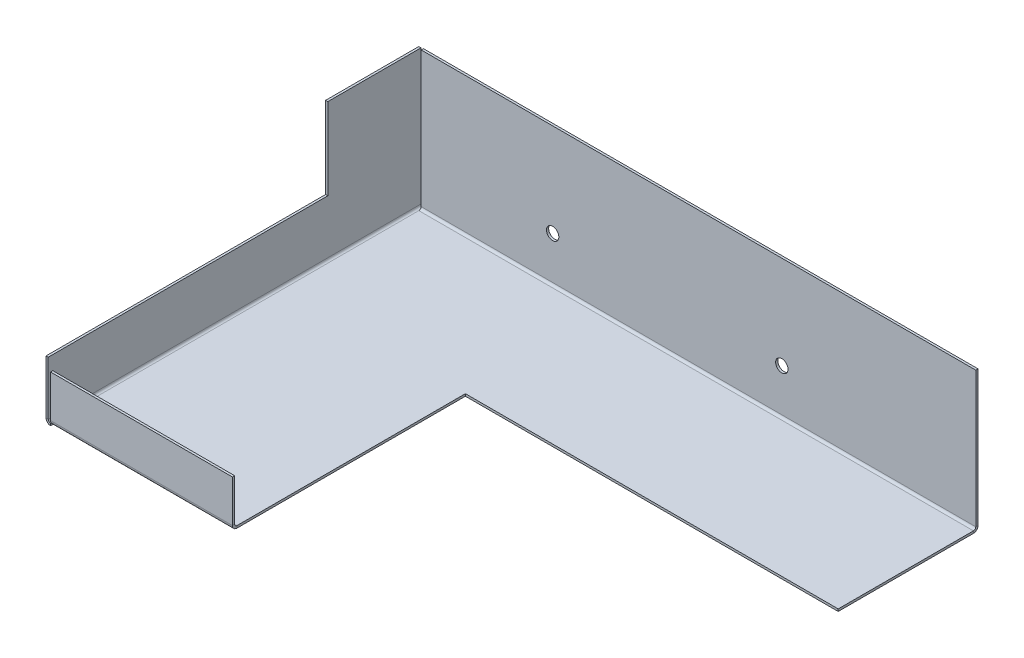
from build123d import *

# Parameters (mm, degrees)
BASE_FLANGE1_DEPTH           = 1.2192
EDGE_FLANGE1_STRIP_W         = 7.4168
EDGE_FLANGE1_STRIP_H         = 1.2192
EDGE_FLANGE1_STRIP_CUT_DEPTH = 203.2
EDGE_FLANGE1_DEPTH           = 203.2
EDGE_FLANGE2_STRIP_W         = 7.4168
EDGE_FLANGE2_STRIP_H         = 1.2192
EDGE_FLANGE2_STRIP_CUT_DEPTH = 302.3108
EDGE_FLANGE2_DEPTH           = 302.3108
F_1_4_0_25_DIAMETER_HOLE1_D  = 6.7564
SKETCH15_W                   = 152.4
SKETCH15_H                   = 44.45
CUT_EXTRUDE2_DEPTH           = 373.975962979
F_1_4_0_25_DIAMETER_HOLE3_D  = 6.7564
EDGE_FLANGE3_STRIP_W         = 7.4168
EDGE_FLANGE3_STRIP_H         = 1.2192
EDGE_FLANGE3_STRIP_CUT_DEPTH = 99.1108
EDGE_FLANGE3_DEPTH           = 99.1108


# Sheet-metal steps are written as plain solids
with BuildPart() as part:
    # Sketch1 → Base-Flange1 (new body)
    with BuildSketch(Plane(origin=(0, 0, 0), x_dir=(1, 0, 0), z_dir=(0, 1, 0))):
        Polygon((0, 0), (0, 203.2), (304.8, 203.2), (304.8, 127), (101.6, 127), (101.6, 0), align=None)
    extrude(amount=-BASE_FLANGE1_DEPTH)

    # Edge-Flange1 strip (across the edge) → Edge-Flange1 strip cut (cut)
    with BuildSketch(Plane.XY.offset(-203.2)):
        with Locations((-1.2192, -0.6096)):
            Rectangle(EDGE_FLANGE1_STRIP_W, EDGE_FLANGE1_STRIP_H)
    extrude(amount=EDGE_FLANGE1_STRIP_CUT_DEPTH, mode=Mode.SUBTRACT)

    # Edge-Flange1 section (across the edge) → Edge-Flange1 (add)
    with BuildSketch(Plane.XY.offset(-203.2)):
        with BuildLine():
            Line((0, 1.27), (0, 74.9808))
            Line((0, 74.9808), (1.2192, 74.9808))
            Line((1.2192, 74.9808), (1.2192, 1.27))
            ThreePointArc((1.2192, 1.27), (1.591174388, 0.371974388), (2.4892, 0))
            Line((2.4892, 0), (2.4892, -1.2192))
            ThreePointArc((2.4892, -1.2192), (0.7290698, -0.4901302), (0, 1.27))
        make_face()
    extrude(amount=EDGE_FLANGE1_DEPTH)

    # Edge-Flange2 strip (across the edge) → Edge-Flange2 strip cut (cut)
    with BuildSketch(Plane(origin=(304.8, 0, -203.2), x_dir=(0, 0, 1), z_dir=(-1, 0, 0))):
        with Locations((-1.2192, -0.6096)):
            Rectangle(EDGE_FLANGE2_STRIP_W, EDGE_FLANGE2_STRIP_H)
    extrude(amount=EDGE_FLANGE2_STRIP_CUT_DEPTH, mode=Mode.SUBTRACT)

    # Edge-Flange2 section (across the edge) → Edge-Flange2 (add)
    with BuildSketch(Plane(origin=(304.8, 0, -203.2), x_dir=(0, 0, 1), z_dir=(-1, 0, 0))):
        with BuildLine():
            Line((0, 1.27), (0, 75.229826743))
            Line((0, 75.229826743), (1.2192, 75.229826743))
            Line((1.2192, 75.229826743), (1.2192, 1.27))
            ThreePointArc((1.2192, 1.27), (1.591174388, 0.371974388), (2.4892, 0))
            Line((2.4892, 0), (2.4892, -1.2192))
            ThreePointArc((2.4892, -1.2192), (0.7290698, -0.4901302), (0, 1.27))
        make_face()
    extrude(amount=EDGE_FLANGE2_DEPTH)

    # 1/4 (0.25) Diameter Hole1 (through all)
    with Locations(Plane(origin=(74.174301672, 24.429826743, -203.2), x_dir=(0, -1, 0), z_dir=(0, 0, -1))):
        with Locations((0, 0)):
            Hole(F_1_4_0_25_DIAMETER_HOLE1_D / 2)

    # Sketch15 → Cut-Extrude2 (cut, through all)
    with BuildSketch(Plane(origin=(1.2192, 0, 0), x_dir=(0, 0, -1), z_dir=(1, 0, 0))):
        with Locations((76.2, 52.7558)):
            Rectangle(SKETCH15_W, SKETCH15_H)
    extrude(amount=-CUT_EXTRUDE2_DEPTH, mode=Mode.SUBTRACT)

    # 1/4 (0.25) Diameter Hole3 (through all)
    with Locations(Plane(origin=(199.080372839, 24.429826743, -203.2), x_dir=(0, -1, 0), z_dir=(0, 0, -1))):
        with Locations((0, 0)):
            Hole(F_1_4_0_25_DIAMETER_HOLE3_D / 2)

    # Edge-Flange3 strip (across the edge) → Edge-Flange3 strip cut (cut)
    with BuildSketch(Plane(origin=(2.4892, 0, 0), x_dir=(0, 0, -1), z_dir=(1, 0, 0))):
        with Locations((-1.2192, -0.6096)):
            Rectangle(EDGE_FLANGE3_STRIP_W, EDGE_FLANGE3_STRIP_H)
    extrude(amount=EDGE_FLANGE3_STRIP_CUT_DEPTH, mode=Mode.SUBTRACT)

    # Edge-Flange3 section (across the edge) → Edge-Flange3 (add)
    with BuildSketch(Plane(origin=(2.4892, 0, 0), x_dir=(0, 0, -1), z_dir=(1, 0, 0))):
        with BuildLine():
            Line((0, 1.27), (0, 24.1808))
            Line((0, 24.1808), (1.2192, 24.1808))
            Line((1.2192, 24.1808), (1.2192, 1.27))
            ThreePointArc((1.2192, 1.27), (1.591174388, 0.371974388), (2.4892, 0))
            Line((2.4892, 0), (2.4892, -1.2192))
            ThreePointArc((2.4892, -1.2192), (0.7290698, -0.4901302), (0, 1.27))
        make_face()
    extrude(amount=EDGE_FLANGE3_DEPTH)


solid = part.part
